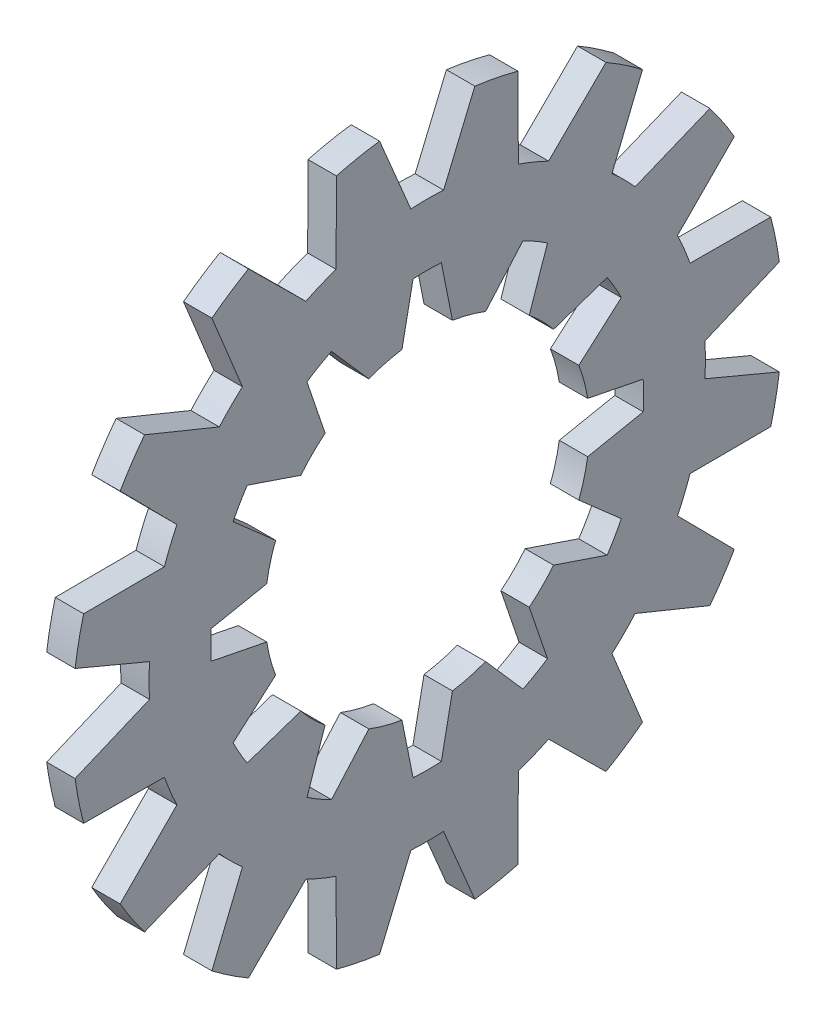
from build123d import *

# Parameters (mm, degrees)
SECSKE_W      = 1.4
SECSKE_H      = 9.5
EXTCUT_DEPTH  = 25.788303693
EXTCUTS_COUNT = 16
EXTCUTS_ANGLE = 337.5
INTCUT_DEPTH  = 25.565286833
INTCUTS_COUNT = 12
INTCUTS_ANGLE = 330


with BuildPart() as part:
    # SecSke → Body (revolve)
    with BuildSketch(Plane.XY):
        with Locations((-0.7, 12.75)):
            Rectangle(SECSKE_W, SECSKE_H)
    revolve(axis=Axis((-34.925, 0, 0), (1, 0, 0)))

    # ExtCutSke → ExtCut (cut, through all)
    with BuildSketch(Plane(origin=(0, 0, 0), x_dir=(0, 0, -1), z_dir=(1, 0, 0))):
        with BuildLine():
            Line((-2.696172468, 18.176118371), (-0.80653001, 13.67623886))
            ThreePointArc((-0.80653001, 13.67623886), (0, 13.7), (0.80653001, 13.67623886))
            Line((0.80653001, 13.67623886), (2.696172468, 18.176118371))
            ThreePointArc((2.696172468, 18.176118371), (0, 18.375), (-2.696172468, 18.176118371))
        make_face()
    extcut = extrude(amount=-EXTCUT_DEPTH, mode=Mode.SUBTRACT)

    # ExtCuts: ExtCut ×16 about axis
    extcuts_axis = Axis((-34.925, 0, 0), (1, 0, 0))
    for i in range(1, EXTCUTS_COUNT):
        add(extcut.rotate(extcuts_axis, i * EXTCUTS_ANGLE / (EXTCUTS_COUNT - 1)), mode=Mode.SUBTRACT)

    # IntCutSke → IntCut (cut, through all)
    with BuildSketch(Plane(origin=(0, 0, 0), x_dir=(0, 0, -1), z_dir=(1, 0, 0))):
        with BuildLine():
            Line((-0.697197358, 10.637176122), (-1.326257139, 7.483384395))
            ThreePointArc((-1.326257139, 7.483384395), (0, 7.6), (1.326257139, 7.483384395))
            Line((1.326257139, 7.483384395), (0.697197358, 10.637176122))
            ThreePointArc((0.697197358, 10.637176122), (0, 10.66), (-0.697197358, 10.637176122))
        make_face()
    intcut = extrude(amount=-INTCUT_DEPTH, mode=Mode.SUBTRACT)

    # IntCuts: IntCut ×12 about axis
    intcuts_axis = Axis((-34.925, 0, 0), (1, 0, 0))
    for i in range(1, INTCUTS_COUNT):
        add(intcut.rotate(intcuts_axis, i * INTCUTS_ANGLE / (INTCUTS_COUNT - 1)), mode=Mode.SUBTRACT)


solid = part.part
